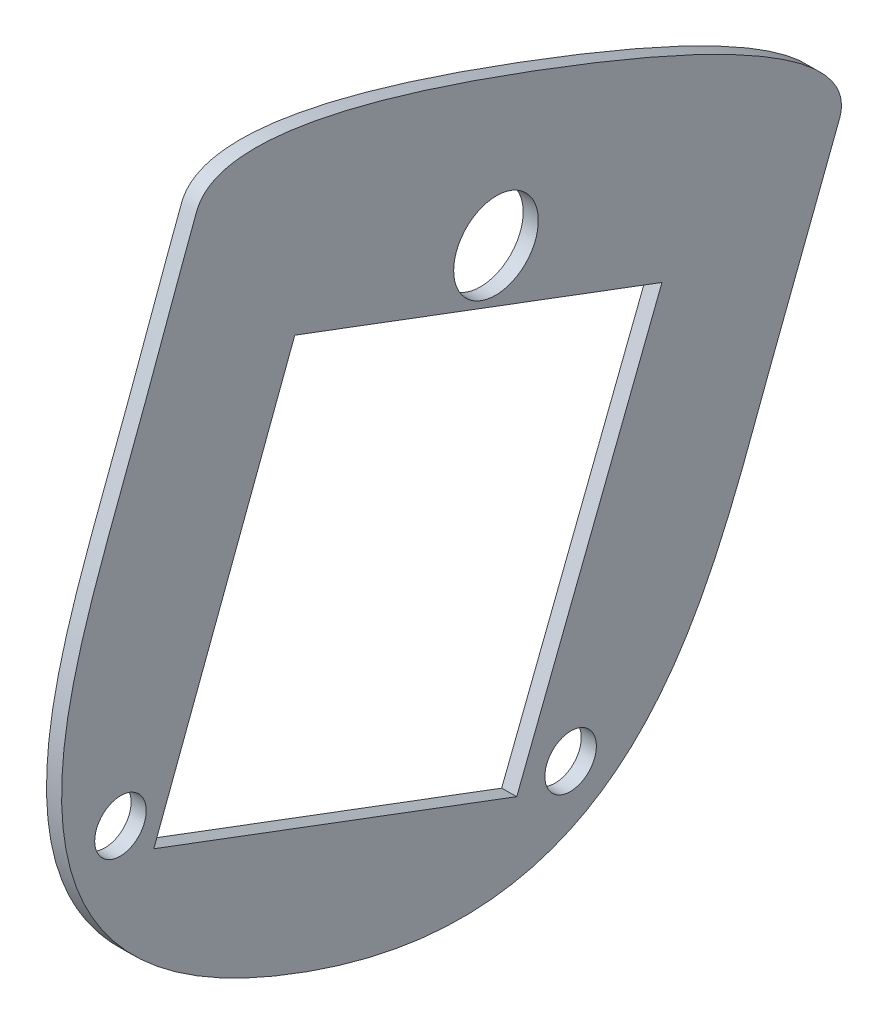
from build123d import *

# Parameters (mm, degrees)
SKETCH3_R           = 11.5
SKETCH3_R_2         = 7
BOSS_EXTRUDE1_DEPTH = 4


with BuildPart() as part:
    # Sketch3 → Boss-Extrude1 (new body)
    with BuildSketch(Plane(origin=(-1179.548631244, -0.000116963, 14.971959902), x_dir=(0.012691934504714668, 1.258519915397729e-09, 0.9999194541554475), z_dir=(-0.9999194541554426, -9.915104323779702e-08, 0.01269193450471473))):
        with BuildLine():
            add(Edge.make_bspline(
                [(84.377905998, 170.073349611), (84.159146209, 170.614103737), (83.611445829, 171.645847401), (82.482488155, 172.968186199), (81.127474205, 174.032815338), (79.625504141, 174.851852168), (78.048065363, 175.46773216), (75.883744714, 176.067351893), (73.137504594, 176.493777281), (69.848329994, 176.668544918), (66.593182125, 176.609478461), (63.378982778, 176.382288344), (60.20731945, 176.028236357), (57.075408808, 175.575862287), (53.980573733, 175.044418403), (50.919287132, 174.448332656), (47.88858994, 173.797522358), (44.885549546, 173.100779506), (40.914701349, 172.117751202), (36.006584389, 170.801928289), (30.186228838, 169.112782921), (24.416677375, 167.331209331), (18.680858867, 165.470954437), (12.962867526, 163.537381585), (7.246752851, 161.536551279), (-0.392782545, 158.779747051), (-6.165961293, 156.613052059), (-13.94829591, 153.628587787), (-19.689671295, 151.379544623), (-27.213353042, 148.32138638), (-32.801411813, 145.987168864), (-38.34590917, 143.60168497), (-43.854658394, 141.149761563), (-49.33590569, 138.616774109), (-54.793159015, 135.98108416), (-59.322515753, 133.677749539), (-62.932447741, 131.753643877), (-65.631328698, 130.263773352), (-68.320076039, 128.721252072), (-70.99499306, 127.117580989), (-73.651650051, 125.443406131), (-76.283024477, 123.685640179), (-78.878235649, 121.828176014), (-81.420273295, 119.847929263), (-83.880369486, 117.71527683), (-86.209443734, 115.385980118), (-87.966528206, 113.232572142), (-89.175083533, 111.339467663), (-89.936337543, 109.826689125), (-90.505629637, 108.213285186), (-90.801403008, 106.515492236), (-90.756707116, 104.777199898), (-90.474046755, 103.643699911), (-90.084384795, 102.569480158), (-89.841034016, 101.911994363), (-89.541465442, 101.124116148), (-89.39022558, 100.730499307), (-89.238048509, 100.337045258), (-89.085953699, 99.943392047), (-88.933536811, 99.549679266), (-88.730132992, 99.024564877), (-88.373481405, 98.105259575), (-87.862190511, 96.790888427), (-87.245924635, 95.211881522), (-86.627148474, 93.631055189), (-86.006043621, 92.048360056), (-85.382804113, 90.46374254), (-84.757617465, 88.87715131), (-84.130649567, 87.288544234), (-83.502064493, 85.697879827), (-82.662014846, 83.574195152), (-81.608733884, 80.914237535), (-80.340964507, 77.713392714), (-79.070680925, 74.503319887), (-77.799405763, 71.283624353), (-76.528661796, 68.053911872), (-75.259433457, 64.814004725), (-73.992705385, 61.563725615), (-72.730871393, 58.302409625), (-71.476325612, 55.029392149), (-69.810026434, 50.651412822), (-67.733040223, 45.155857397), (-65.192889969, 38.548535597), (-63.002092293, 33.047031135), (-61.179682785, 28.661451936), (-60.006324985, 25.929654584), (-59.043849556, 23.751341903), (-58.309275854, 22.121773372), (-57.56111242, 20.496992747), (-56.798597272, 18.877580965), (-56.02074925, 17.264200326), (-55.227016605, 15.657353665), (-54.415921139, 14.057888772), (-52.755061989, 10.875871272), (-50.113640526, 6.170533326), (-46.214055624, 0.106202959), (-41.879815211, -5.682640377), (-37.071022669, -11.095491143), (-31.749304366, -16.030968238), (-26.892659915, -19.643471605), (-22.77171096, -22.182742504), (-18.509010649, -24.473419396), (-12.935749295, -26.848778135), (-5.968718292, -28.897564796), (1.173532604, -30.167771585), (8.394625718, -30.72426012), (15.629246847, -30.639249774), (22.822176795, -29.99272502), (29.944943646, -28.856179071), (36.971413373, -27.310529127), (46.200981004, -24.782274948), (52.958186926, -22.450860484), (61.81972476, -19.052528076), (68.404073328, -16.267470827), (76.95838131, -11.975451151), (83.217088787, -8.426029178), (89.273667966, -4.508006235), (95.054577362, -0.17870119), (100.490854379, 4.595986977), (105.487967549, 9.838586932), (109.949080227, 15.559099084), (113.759190042, 21.741276151), (116.314593096, 27.234185766), (117.952211322, 31.787728825), (119.31821366, 36.431290069), (120.513597166, 42.364707849), (121.170203082, 49.592689871), (121.126324228, 56.832595149), (120.478268293, 64.034720651), (119.322900557, 71.151036814), (118.140760893, 76.415668184), (117.248089102, 79.892054693), (116.781726531, 81.623608795), (116.297499658, 83.349034553), (115.797104501, 85.068701615), (115.281277137, 86.782601375), (114.751194296, 88.490899321), (114.207808244, 90.193672228), (113.466976478, 92.456831493), (112.512877939, 95.2725252), (110.935633256, 99.751829279), (108.886186051, 105.307189462), (106.357132583, 111.918384124), (104.227035857, 117.393292318), (102.538795023, 121.76266191), (101.283192002, 125.035142736), (100.040826281, 128.303809705), (98.809473322, 131.567557235), (97.586908616, 134.825280211), (96.372281382, 138.076452947), (95.164740704, 141.32055023), (93.962890537, 144.556847836), (92.765334624, 147.784622), (91.769947764, 150.466802963), (90.974582637, 152.607652643), (90.37838073, 154.210763325), (89.782350048, 155.811268218), (89.186340893, 157.409088573), (88.590201531, 159.004144829), (87.993758439, 160.596349912), (87.396830825, 162.185613775), (86.799251704, 163.771852109), (86.300563928, 165.091116339), (85.951056972, 166.013206231), (85.751175589, 166.539698033), (85.601252796, 166.934387123), (85.451115071, 167.328812398), (85.301183692, 167.723146525), (85.150455373, 168.116984379), (84.846354037, 168.903163888), (84.587677769, 169.554813042), (84.377905998, 170.073349611)],
                knots=[0, 0, 0, 0, 0.002677759, 0.005355518, 0.008033277, 0.010711036, 0.013388795, 0.016066554, 0.021422071, 0.026777589, 0.032133107, 0.037488625, 0.042844143, 0.048199661, 0.053555179, 0.058910696, 0.064266214, 0.069621732, 0.07497725, 0.085688286, 0.096399321, 0.107110357, 0.117821393, 0.128532429, 0.139243464, 0.1499545, 0.171376571, 0.171376571, 0.192798208, 0.203509027, 0.214219845, 0.224930663, 0.235641482, 0.2463523, 0.257063118, 0.267773937, 0.273129346, 0.278484755, 0.283840164, 0.289195574, 0.294550983, 0.299906392, 0.305261801, 0.31061721, 0.31597262, 0.321328029, 0.326683438, 0.329361143, 0.332038847, 0.334716552, 0.337394256, 0.340071961, 0.342749665, 0.342749665, 0.345316694, 0.345958451, 0.346600208, 0.347241965, 0.347883722, 0.348525479, 0.349167236, 0.350450751, 0.353017779, 0.355584807, 0.358151836, 0.360718864, 0.363285893, 0.365852921, 0.368419949, 0.370986978, 0.373554006, 0.378688063, 0.38382212, 0.388956176, 0.394090233, 0.39922429, 0.404358347, 0.409492403, 0.41462646, 0.419760517, 0.424894574, 0.435162687, 0.445430801, 0.455698914, 0.460832971, 0.465967028, 0.468534056, 0.471101084, 0.473668113, 0.476235141, 0.478802169, 0.481369198, 0.483936226, 0.486503255, 0.496771368, 0.507039482, 0.517307595, 0.527575709, 0.537843822, 0.548111936, 0.553245992, 0.558380049, 0.568648163, 0.578916276, 0.58918439, 0.599452503, 0.609720617, 0.61998873, 0.630256844, 0.640524957, 0.650793071, 0.671329298, 0.671329298, 0.691871217, 0.702142176, 0.712413135, 0.722684095, 0.732955054, 0.743226014, 0.753496973, 0.763767933, 0.774038892, 0.784309852, 0.789445331, 0.794580811, 0.80485177, 0.81512273, 0.825393689, 0.835664649, 0.845935608, 0.856206568, 0.858774308, 0.861342047, 0.863909787, 0.866477527, 0.869045267, 0.871613007, 0.874180747, 0.876748487, 0.881883966, 0.887019446, 0.897290406, 0.907561365, 0.917832324, 0.922967804, 0.928103284, 0.933238764, 0.938374243, 0.943509723, 0.948645203, 0.953780682, 0.958916162, 0.964051642, 0.969187122, 0.971754862, 0.974322601, 0.976890341, 0.979458081, 0.982025821, 0.984593561, 0.987161301, 0.989729041, 0.99229678, 0.99358065, 0.994222585, 0.99486452, 0.995506455, 0.99614839, 0.996790325, 0.99743226, 1, 1, 1, 1], degree=3))
        make_face()
        with Locations((3.088369787, 120.842225121)):
            Circle(SKETCH3_R, mode=Mode.SUBTRACT)
        with Locations((-17.186648299, -9.215855238)):
            Circle(SKETCH3_R_2, mode=Mode.SUBTRACT)
        Polygon((57.758645348, 127.697266706), (96.07163251, 27.791736255), (-2.550077052, -10.028915669), (-42.009063527, 89.437133036), align=None, mode=Mode.SUBTRACT)
        with Locations((105.127599262, 37.690699139)):
            Circle(SKETCH3_R_2, mode=Mode.SUBTRACT)
    extrude(amount=-BOSS_EXTRUDE1_DEPTH)


solid = part.part
